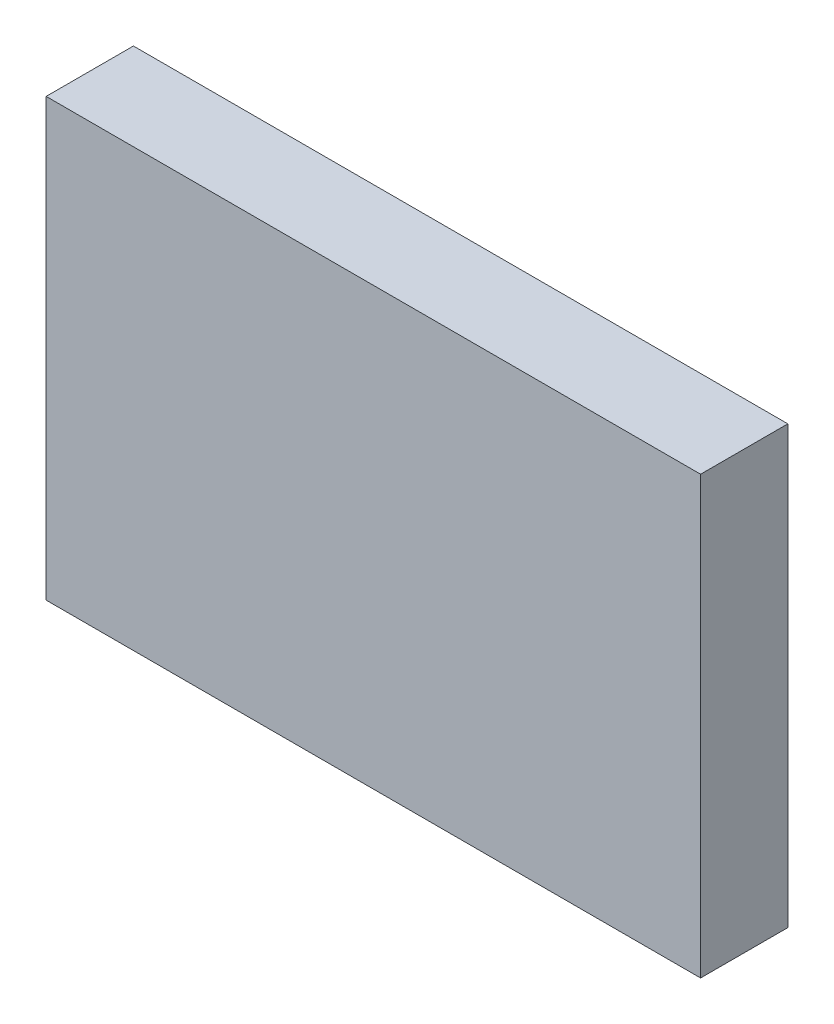
from build123d import *

# Parameters (mm, degrees)
SKETCH2_W           = 30
SKETCH2_H           = 20
BOSS_EXTRUDE1_DEPTH = 4


with BuildPart() as part:
    # Sketch2 → Boss-Extrude1 (new body)
    with BuildSketch(Plane.XY):
        with Locations((15, 10)):
            Rectangle(SKETCH2_W, SKETCH2_H)
    extrude(amount=BOSS_EXTRUDE1_DEPTH)


solid = part.part
